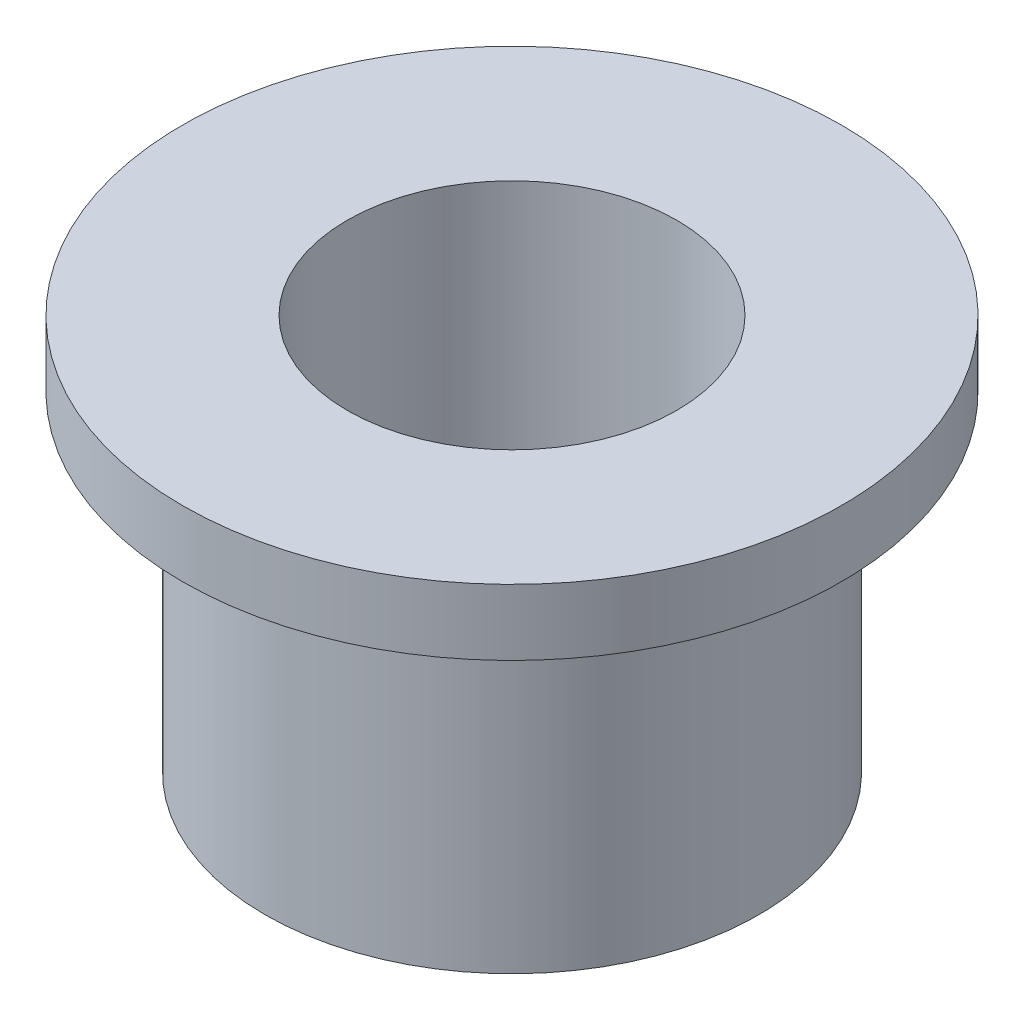
from build123d import *


with BuildPart() as part:
    # Sketch1 → Revolve1 (revolve)
    with BuildSketch(Plane.XY):
        Polygon((5, 1.032258065), (5, -10.967741935), (7.5, -10.967741935), (7.5, -0.967741935), (10, -0.967741935), (10, 1.032258065), align=None)
    revolve(axis=Axis((0, 0, 0), (0, -1, 0)))


solid = part.part
